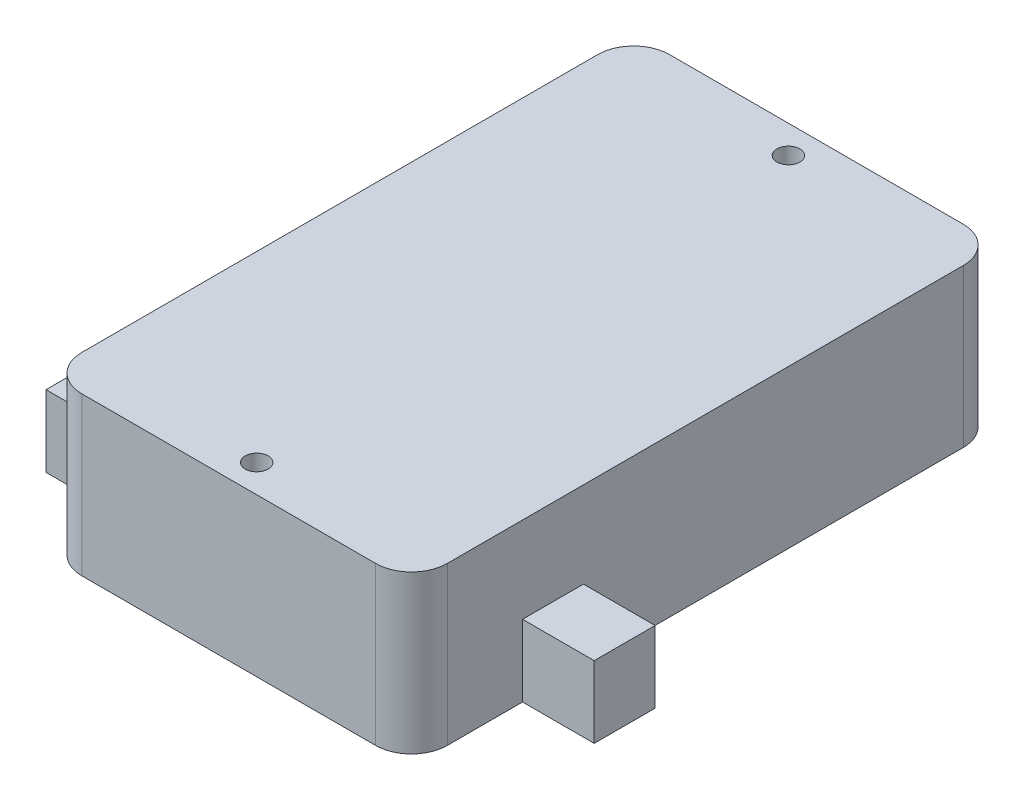
from build123d import *

# Parameters (mm, degrees)
SKETCH1_R           = 1.6
BOSS_EXTRUDE1_DEPTH = 22
SKETCH1_3_W         = 10
SKETCH1_3_H         = 26
SKETCH1_3_H_2       = 8.5
BOSS_EXTRUDE2_DEPTH = 10
FILLET1_R           = 5


with BuildPart() as part:
    # Sketch1 → Boss-Extrude1 (new body)
    with BuildSketch(Plane(origin=(0, 0, 0), x_dir=(1, 0, 0), z_dir=(0, 1, 0))):
        Polygon((-25.5, -31), (-25.5, -41), (25.5, -41), (25.5, -25.5), (25.5, -17), (25.5, 41), (-25.5, 41), (-25.5, -5), align=None)
        with Locations((0, -37.1)):
            Circle(SKETCH1_R, mode=Mode.SUBTRACT)
        with Locations((0, 37.1)):
            Circle(SKETCH1_R, mode=Mode.SUBTRACT)
    extrude(amount=BOSS_EXTRUDE1_DEPTH)

    # Sketch1<3> → Boss-Extrude2 (add)
    with BuildSketch(Plane(origin=(0, 0, 0), x_dir=(1, 0, 0), z_dir=(0, 1, 0))):
        with Locations((-30.5, -18)):
            Rectangle(SKETCH1_3_W, SKETCH1_3_H)
        with Locations((30.5, -21.25)):
            Rectangle(SKETCH1_3_W, SKETCH1_3_H_2)
    extrude(amount=BOSS_EXTRUDE2_DEPTH)

    # Fillet1
    fillet1_edges = [part.edges().sort_by_distance(p)[0] for p in [
        (-25.5, 11, -41),
        (25.5, 11, -41),
        (25.5, 11, 41),
        (-25.5, 11, 41),
    ]]
    fillet(fillet1_edges, radius=FILLET1_R)


solid = part.part
